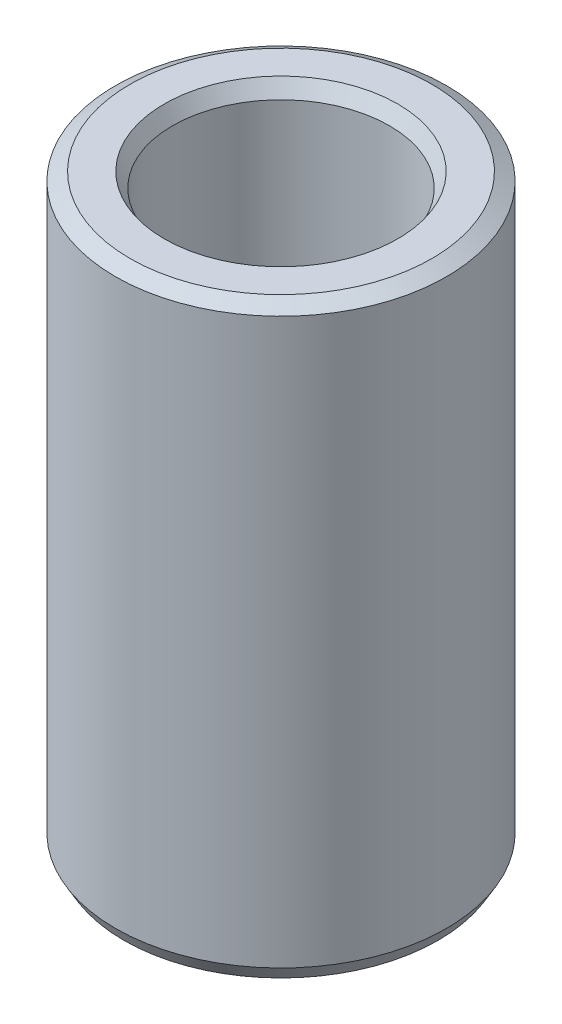
from build123d import *
from OCP.BRepFilletAPI import BRepFilletAPI_MakeChamfer

# Parameters (mm, degrees)
SKETCH1_R           = 40
BOSS_EXTRUDE1_DEPTH = 141.94382319
SKETCH2_R           = 26.190465466
CUT_EXTRUDE1_DEPTH  = 153.800683708
CHAMFER1_SIZE       = 2.035699697
CHAMFER1_SIZE2      = 3.525935304


with BuildPart() as part:
    # Sketch1 → Boss-Extrude1 (new body)
    with BuildSketch(Plane(origin=(0, 0, 0), x_dir=(1, 0, 0), z_dir=(0, 1, 0))):
        Circle(SKETCH1_R)
    extrude(amount=BOSS_EXTRUDE1_DEPTH)

    # Sketch2 → Cut-Extrude1 (cut, through all)
    with BuildSketch(Plane(origin=(0, 0, 0), x_dir=(1, 0, 0), z_dir=(0, 1, 0))):
        Circle(SKETCH2_R)
    extrude(amount=CUT_EXTRUDE1_DEPTH, mode=Mode.SUBTRACT)

    # Chamfer1: one chamfer whose edges measure the first distance from different faces: ONE call of the kernel's chamfer builder (chamfer() names one face for all edges)
    chamfer1_edges_1 = [part.edges().sort_by_distance(p)[0] for p in [
        (-26.190465466, 141.94382319, 0),
    ]]
    chamfer1_side_1 = [part.faces().sort_by_distance(p)[0] for p in [
        (-38.86862915, 141.94382319, 0),
    ]]
    chamfer1_edges_2 = [part.edges().sort_by_distance(p)[0] for p in [
        (-26.190465466, 0, 0),
    ]]
    chamfer1_side_2 = [part.faces().sort_by_distance(p)[0] for p in [
        (-26.190465466, 70.971911595, 0),
    ]]
    chamfer1_edges_3 = [part.edges().sort_by_distance(p)[0] for p in [
        (-40, 0, 0),
    ]]
    chamfer1_side_3 = [part.faces().sort_by_distance(p)[0] for p in [
        (-38.86862915, 0, 0),
    ]]
    chamfer1_edges_4 = [part.edges().sort_by_distance(p)[0] for p in [
        (-40, 141.94382319, 0),
    ]]
    chamfer1_side_4 = [part.faces().sort_by_distance(p)[0] for p in [
        (-40, 70.971911595, 0),
    ]]
    chamfer1 = BRepFilletAPI_MakeChamfer(part.part.solid().wrapped)
    for e in chamfer1_edges_1:
        chamfer1.Add(CHAMFER1_SIZE, CHAMFER1_SIZE2, e.wrapped, chamfer1_side_1[0].wrapped)  # the first distance lies on this face
    for e in chamfer1_edges_2:
        chamfer1.Add(CHAMFER1_SIZE, CHAMFER1_SIZE2, e.wrapped, chamfer1_side_2[0].wrapped)  # the first distance lies on this face
    for e in chamfer1_edges_3:
        chamfer1.Add(CHAMFER1_SIZE, CHAMFER1_SIZE2, e.wrapped, chamfer1_side_3[0].wrapped)  # the first distance lies on this face
    for e in chamfer1_edges_4:
        chamfer1.Add(CHAMFER1_SIZE, CHAMFER1_SIZE2, e.wrapped, chamfer1_side_4[0].wrapped)  # the first distance lies on this face
    add(Compound.cast(chamfer1.Shape()), mode=Mode.REPLACE)


solid = part.part
